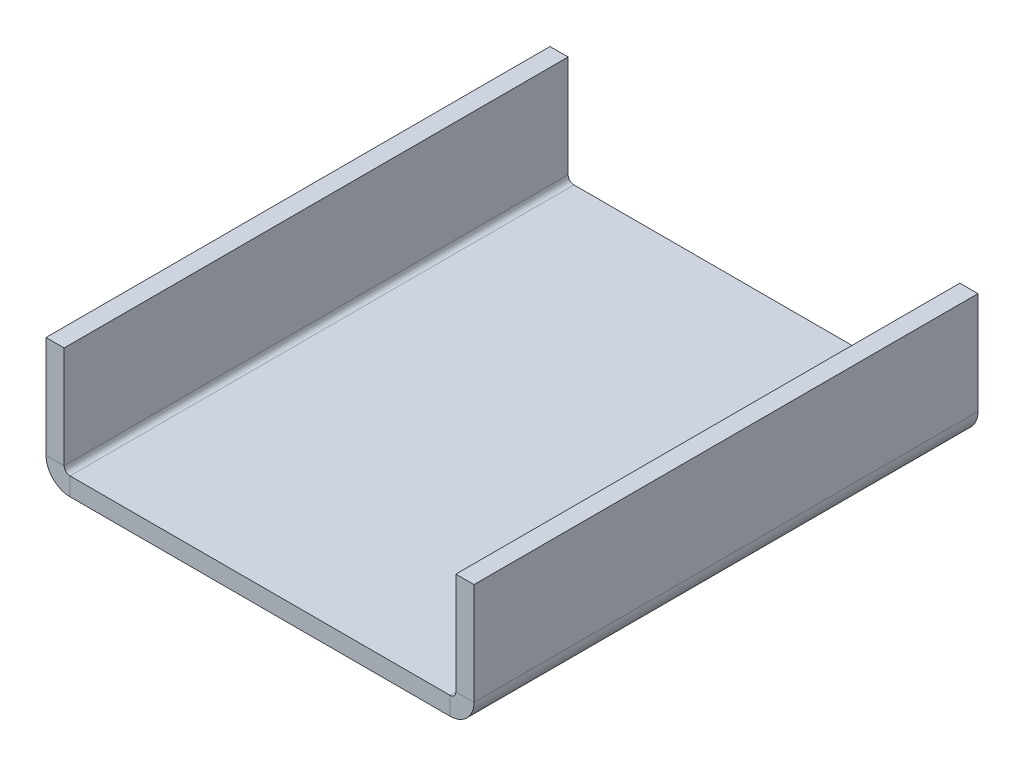
from build123d import *

# Parameters (mm, degrees)
SKETCH1_W                      = 53.9242
SKETCH1_H                      = 63.5
BASE_FLANGE2_DEPTH             = 2.286
EDGE_FLANGE1_STRIP_W           = 10.6172
EDGE_FLANGE1_STRIP_H           = 2.286
EDGE_FLANGE1_STRIP_CUT_DEPTH   = 63.5
EDGE_FLANGE1_STRIP_2_W         = 10.6172
EDGE_FLANGE1_STRIP_2_H         = 2.286
EDGE_FLANGE1_STRIP_CUT_2_DEPTH = 63.5
EDGE_FLANGE1_DEPTH             = 63.5
EDGE_FLANGE1_BEND_DEPTH        = 63.5


# Sheet-metal steps are written as plain solids
with BuildPart() as part:
    # Sketch1 → Base-Flange2 (new body)
    with BuildSketch(Plane(origin=(0, 0, 0), x_dir=(1, 0, 0), z_dir=(0, 1, 0))):
        Rectangle(SKETCH1_W, SKETCH1_H)
    extrude(amount=-BASE_FLANGE2_DEPTH)

    # Edge-Flange1 strip (across the edge) → Edge-Flange1 strip cut (cut)
    with BuildSketch(Plane(origin=(-26.9621, 0, -31.75), x_dir=(1, 0, 0), z_dir=(0, 0, 1))):
        with Locations((-2.286, -1.143)):
            Rectangle(EDGE_FLANGE1_STRIP_W, EDGE_FLANGE1_STRIP_H)
    extrude(amount=EDGE_FLANGE1_STRIP_CUT_DEPTH, mode=Mode.SUBTRACT)

    # Edge-Flange1 strip 2 (across the edge) → Edge-Flange1 strip cut 2 (cut)
    with BuildSketch(Plane(origin=(26.9621, 0, 31.75), x_dir=(-1, 0, 0), z_dir=(0, 0, -1))):
        with Locations((-2.286, -1.143)):
            Rectangle(EDGE_FLANGE1_STRIP_2_W, EDGE_FLANGE1_STRIP_2_H)
    extrude(amount=EDGE_FLANGE1_STRIP_CUT_2_DEPTH, mode=Mode.SUBTRACT)

    # Edge-Flange1 section (across the edge) → Edge-Flange1 (add)
    with BuildSketch(Plane(origin=(-26.9621, 0, -31.75), x_dir=(1, 0, 0), z_dir=(0, 0, 1))):
        with BuildLine():
            Line((0, 0.7366), (0, 13.589))
            Line((0, 13.589), (2.286, 13.589))
            Line((2.286, 13.589), (2.286, 0.7366))
            ThreePointArc((2.286, 0.7366), (2.501745145, 0.215745145), (3.0226, 0))
            Line((3.0226, 0), (3.0226, -2.286))
            ThreePointArc((3.0226, -2.286), (0.885299043, -1.400700957), (0, 0.7366))
        make_face()
    extrude(amount=EDGE_FLANGE1_DEPTH)

    # Edge-Flange1 section 2 (across the edge) → Edge-Flange1 bend (add)
    with BuildSketch(Plane(origin=(26.9621, 0, 31.75), x_dir=(-1, 0, 0), z_dir=(0, 0, -1))):
        with BuildLine():
            Line((0, 0.7366), (0, 13.589))
            Line((0, 13.589), (2.286, 13.589))
            Line((2.286, 13.589), (2.286, 0.7366))
            ThreePointArc((2.286, 0.7366), (2.501745145, 0.215745145), (3.0226, 0))
            Line((3.0226, 0), (3.0226, -2.286))
            ThreePointArc((3.0226, -2.286), (0.885299043, -1.400700957), (0, 0.7366))
        make_face()
    extrude(amount=EDGE_FLANGE1_BEND_DEPTH)


solid = part.part
